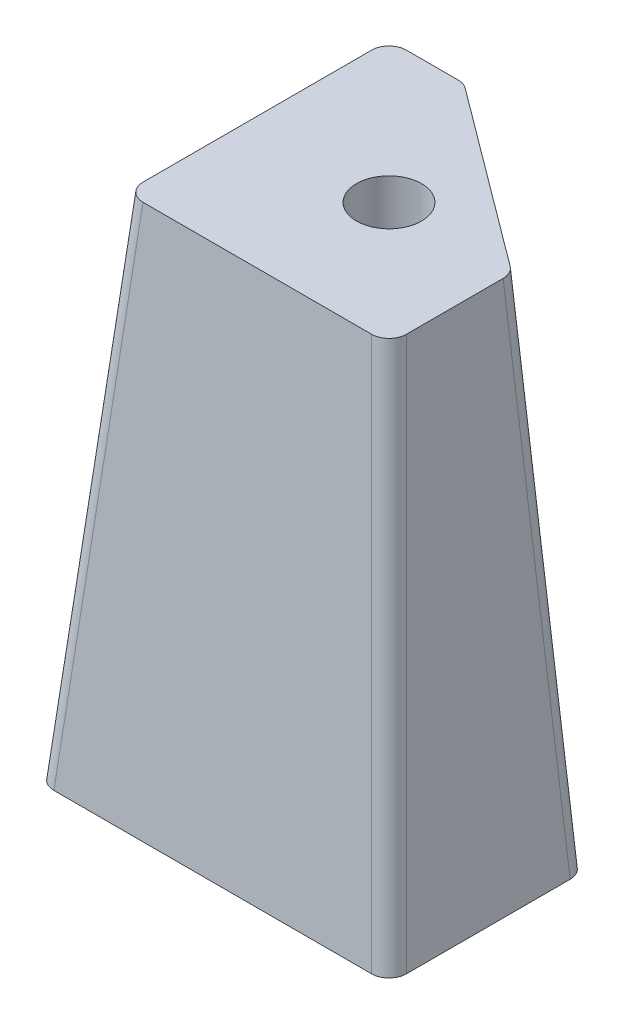
from build123d import *

# Parameters (mm, degrees)
BOSS_EXTRUDE1_DEPTH = 29
SKETCH2_R           = 2
SKETCH2_R_2         = 1.5
CUT_EXTRUDE1_DEPTH  = 10
SKETCH3_R           = 1.85
CUT_EXTRUDE2_DEPTH  = 12
DRAFT1_ANGLE        = 5
FILLET1_R           = 1


with BuildPart() as part:
    # Sketch1 → Boss-Extrude1 (new body)
    with BuildSketch(Plane(origin=(0, 0, 0), x_dir=(1, 0, 0), z_dir=(0, 1, 0))):
        Polygon((10.420353982, -7.201327434), (-4.579646018, -7.201327434), (-4.579646018, 7.798672566), (-0.312469404, 7.798672566), (10.420353982, -0.201327434), align=None)
    extrude(amount=BOSS_EXTRUDE1_DEPTH)

    # Sketch2 → Cut-Extrude1 (cut)
    with BuildSketch(Plane.XZ):
        with Locations((-0.579646018, 2.201327434)):
            Circle(SKETCH2_R)
        with Locations((7.420353982, 2.201327434)):
            Circle(SKETCH2_R_2)
    extrude(amount=-CUT_EXTRUDE1_DEPTH, mode=Mode.SUBTRACT)

    # Sketch3 → Cut-Extrude2 (cut)
    with BuildSketch(Plane(origin=(0, 29, 0), x_dir=(1, 0, 0), z_dir=(0, 1, 0))):
        with Locations((3.420353982, -0.201327434)):
            Circle(SKETCH3_R)
    extrude(amount=-CUT_EXTRUDE2_DEPTH, mode=Mode.SUBTRACT)

    # Draft1
    draft1_faces = [part.faces().sort_by_distance(p)[0] for p in [
        (5.053942289, 14.5, -3.798672566),
        (-2.446057711, 14.5, -7.798672566),
        (-4.579646018, 14.5, -0.298672566),
        (10.420353982, 14.5, 3.701327434),
        (2.920353982, 14.5, 7.201327434),
    ]]
    draft(draft1_faces, Plane.ZX.offset(29), DRAFT1_ANGLE)

    # Fillet1
    fillet1_edges = [part.edges().sort_by_distance(p)[0] for p in [
        (-5.848231639, 14.5, 8.469913055),
        (11.688939603, 14.5, 8.469913055),
        (-5.848231639, 14.5, -9.067258187),
        (0.108303665, 14.5, -9.067258187),
        (11.688939603, 14.5, -0.435318187),
    ]]
    fillet(fillet1_edges, radius=FILLET1_R)


solid = part.part
